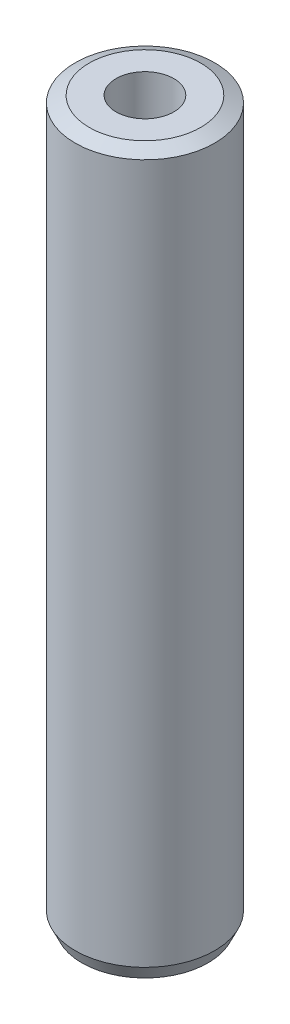
from build123d import *
from OCP.BRepFilletAPI import BRepFilletAPI_MakeChamfer

# Parameters (mm, degrees)
SKETCH1_R           = 35
BOSS_EXTRUDE1_DEPTH = 361.422392352
SKETCH2_R           = 14.509881211
CUT_EXTRUDE1_DEPTH  = 365.796033001
CHAMFER1_SIZE       = 3.337767815
CHAMFER1_SIZE2      = 6.998454172


with BuildPart() as part:
    # Sketch1 → Boss-Extrude1 (new body)
    with BuildSketch(Plane(origin=(0, 0, 0), x_dir=(1, 0, 0), z_dir=(0, 1, 0))):
        Circle(SKETCH1_R)
    extrude(amount=BOSS_EXTRUDE1_DEPTH)

    # Sketch2 → Cut-Extrude1 (cut, through all)
    with BuildSketch(Plane(origin=(0, 0, 0), x_dir=(1, 0, 0), z_dir=(0, 1, 0))):
        Circle(SKETCH2_R)
    extrude(amount=CUT_EXTRUDE1_DEPTH, mode=Mode.SUBTRACT)

    # Chamfer1: one chamfer whose edges measure the first distance from different faces: ONE call of the kernel's chamfer builder (chamfer() names one face for all edges)
    chamfer1_edges_1 = [part.edges().sort_by_distance(p)[0] for p in [
        (-35, 361.422392352, 0),
    ]]
    chamfer1_side_1 = [part.faces().sort_by_distance(p)[0] for p in [
        (-35, 180.711196176, 0),
    ]]
    chamfer1_edges_2 = [part.edges().sort_by_distance(p)[0] for p in [
        (-35, 0, 0),
    ]]
    chamfer1_side_2 = [part.faces().sort_by_distance(p)[0] for p in [
        (-34.010050506, 0, 0),
    ]]
    chamfer1 = BRepFilletAPI_MakeChamfer(part.part.solid().wrapped)
    for e in chamfer1_edges_1:
        chamfer1.Add(CHAMFER1_SIZE, CHAMFER1_SIZE2, e.wrapped, chamfer1_side_1[0].wrapped)  # the first distance lies on this face
    for e in chamfer1_edges_2:
        chamfer1.Add(CHAMFER1_SIZE, CHAMFER1_SIZE2, e.wrapped, chamfer1_side_2[0].wrapped)  # the first distance lies on this face
    add(Compound.cast(chamfer1.Shape()), mode=Mode.REPLACE)


solid = part.part
